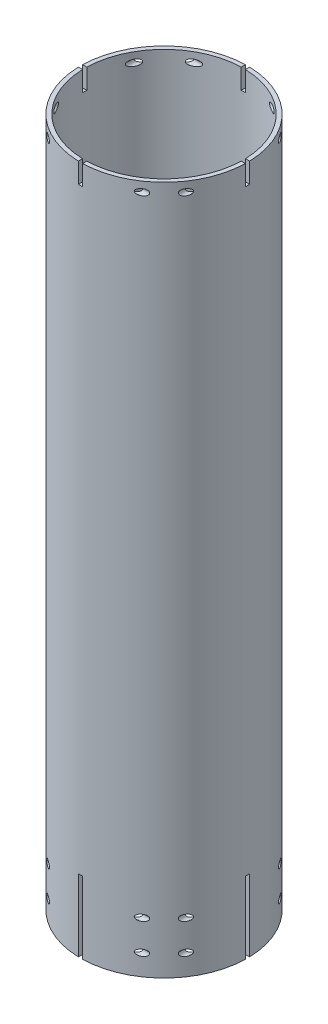
from build123d import *

# Parameters (mm, degrees)
SKETCH1_R               = 40
SKETCH1_R_2             = 38
BOSS_EXTRUDE1_DEPTH     = 330
CUT_EXTRUDE1_DEPTH      = 335.93432192
CUT_EXTRUDE1_DEPTH_BACK = 335.93432192
SKETCH2_R               = 1.5
CUT_EXTRUDE2_DEPTH      = 338.437401729
CUT_EXTRUDE2_DEPTH_BACK = 338.437401729
SKETCH5_W               = 2
SKETCH5_H               = 34.5
SKETCH5_H_2             = 20
CUT_EXTRUDE3_DEPTH      = 342.44399261
CUT_EXTRUDE3_DEPTH_BACK = 342.44399261
SKETCH6_W               = 2
SKETCH6_H               = 34.5
SKETCH6_H_2             = 9.620191517
CUT_EXTRUDE4_DEPTH      = 337.007440519
CUT_EXTRUDE4_DEPTH_BACK = 337.007440519
SKETCH7_R               = 1.5
CUT_EXTRUDE5_DEPTH      = 335.934322043
CUT_EXTRUDE5_DEPTH_BACK = 335.934322043
SKETCH8_R               = 1.5


with BuildPart() as part:
    # Sketch1 → Boss-Extrude1 (new body)
    with BuildSketch(Plane(origin=(0, 0, 0), x_dir=(1, 0, 0), z_dir=(0, 1, 0))):
        Circle(SKETCH1_R)
        Circle(SKETCH1_R_2, mode=Mode.SUBTRACT)
    extrude(amount=BOSS_EXTRUDE1_DEPTH)

    # Sketch2 → Cut-Extrude1 (cut, two sides: drawn at the far end of the back side and taken through both)
    with BuildSketch(Plane.XY.offset(1).offset(-CUT_EXTRUDE1_DEPTH_BACK)):
        with Locations((32.986839826, 24.5)):
            Circle(SKETCH2_R)
        with Locations((32.986839826, 10)):
            Circle(SKETCH2_R)
        with Locations((-32.986839826, 24.5)):
            Circle(SKETCH2_R)
        with Locations((-32.986839826, 10)):
            Circle(SKETCH2_R)
        with Locations((32.986839826, 325.379808483)):
            Circle(SKETCH2_R)
        with Locations((-32.986839826, 325.379808483)):
            Circle(SKETCH2_R)
    extrude(amount=CUT_EXTRUDE1_DEPTH + CUT_EXTRUDE1_DEPTH_BACK, mode=Mode.SUBTRACT)

    # Sketch5 → Cut-Extrude2 (cut, two sides: drawn at the far end of the back side and taken through both)
    with BuildSketch(Plane.ZY.offset(-18).offset(-CUT_EXTRUDE2_DEPTH_BACK)):
        with Locations((0, 17.25)):
            Rectangle(SKETCH5_W, SKETCH5_H)
        with Locations((0, 330.379808483)):
            Rectangle(SKETCH5_W, SKETCH5_H_2)
    extrude(amount=CUT_EXTRUDE2_DEPTH + CUT_EXTRUDE2_DEPTH_BACK, mode=Mode.SUBTRACT)

    # Sketch6 → Cut-Extrude3 (cut, two sides: drawn at the far end of the back side and taken through both)
    with BuildSketch(Plane.XY.offset(38).offset(-CUT_EXTRUDE3_DEPTH_BACK)):
        with Locations((0, 17.25)):
            Rectangle(SKETCH6_W, SKETCH6_H)
        with Locations((0, 325.189904242)):
            Rectangle(SKETCH6_W, SKETCH6_H_2)
    extrude(amount=CUT_EXTRUDE3_DEPTH + CUT_EXTRUDE3_DEPTH_BACK, mode=Mode.SUBTRACT)

    # Sketch7 → Cut-Extrude4 (cut, two sides: drawn at the far end of the back side and taken through both)
    with BuildSketch(Plane(origin=(9, 0, 0), x_dir=(0, 0, -1), z_dir=(1, 0, 0)).offset(-CUT_EXTRUDE4_DEPTH_BACK)):
        with Locations((-33, 24.5)):
            Circle(SKETCH7_R)
        with Locations((-33, 10)):
            Circle(SKETCH7_R)
        with Locations((33, 24.5)):
            Circle(SKETCH7_R)
        with Locations((33, 10)):
            Circle(SKETCH7_R)
    extrude(amount=CUT_EXTRUDE4_DEPTH + CUT_EXTRUDE4_DEPTH_BACK, mode=Mode.SUBTRACT)

    # Sketch8 → Cut-Extrude5 (cut, two sides: drawn at the far end of the back side and taken through both)
    with BuildSketch(Plane.ZY.offset(-1).offset(-CUT_EXTRUDE5_DEPTH_BACK)):
        with Locations((-32.986839826, 325.379808483)):
            Circle(SKETCH8_R)
        with Locations((32.986839826, 325.379808483)):
            Circle(SKETCH8_R)
    extrude(amount=CUT_EXTRUDE5_DEPTH + CUT_EXTRUDE5_DEPTH_BACK, mode=Mode.SUBTRACT)


solid = part.part
